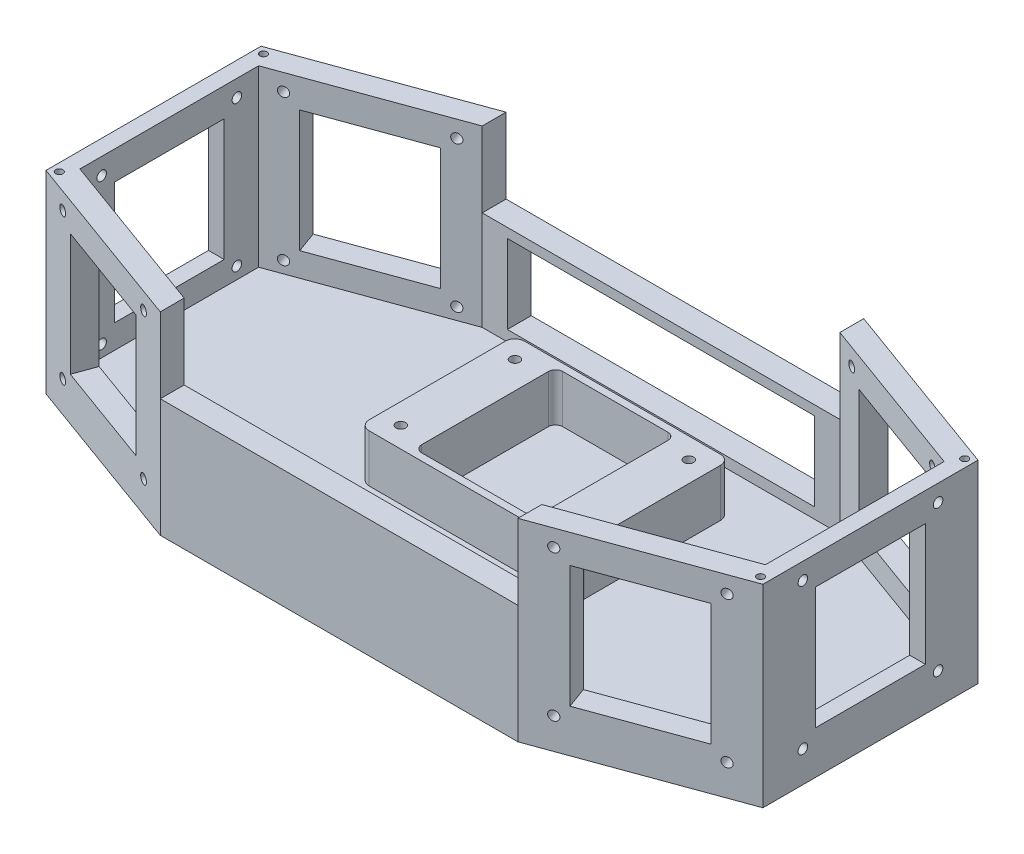
from build123d import *

# Parameters (mm, degrees)
BOSS_EXTRUDE1_DEPTH     = 8
SKETCH2_W               = 10.5
SKETCH2_H               = 10
BOSS_EXTRUDE2_DEPTH     = 37.5
SKETCH4_W               = 128.649180674
SKETCH4_H               = 10
BOSS_EXTRUDE4_DEPTH     = 4.5
BOSS_EXTRUDE5_DEPTH     = 10
SKETCH6_W               = 149.649180674
SKETCH6_H               = 10
BOSS_EXTRUDE6_DEPTH     = 4
CUT_EXTRUDE1_REACH      = 249.54
SKETCH7_R               = 2
MIRROR2_COPY_1_REACH    = 249.54
MIRROR2_COPY_1_SKETCH_R = 2
CUT_EXTRUDE2_REACH      = 314.548
SKETCH8_R               = 2
BOSS_EXTRUDE8_DEPTH     = 63
CUT_EXTRUDE3_REACH      = 257.708
SKETCH10_R              = 2
MIRROR5_COPY_1_REACH    = 257.708
MIRROR5_COPY_1_SKETCH_R = 2
CUT_EXTRUDE4_REACH      = 321.057
SKETCH11_R              = 2
SKETCH12_W              = 6.577848346
SKETCH12_H              = 46
BOSS_EXTRUDE9_DEPTH     = 12
BOSS_EXTRUDE10_DEPTH    = 20
SKETCH14_R              = 2
CUT_EXTRUDE5_DEPTH      = 10
SKETCH15_W              = 149.649180674
SKETCH15_H              = 10
BOSS_EXTRUDE11_DEPTH    = 41.5
SKETCH17_R              = 1.5
CUT_EXTRUDE6_DEPTH      = 10


with BuildPart() as part:
    # Sketch1 → Boss-Extrude1 (new body)
    with BuildSketch(Plane(origin=(0, 0, 0), x_dir=(1, 0, 0), z_dir=(0, 1, 0))):
        Polygon((-150, 45), (-150, -45), (-74.824590337, -72.361611466), (74.824590337, -72.361611466), (150, -45), (150, 45), (74.824590337, 72.361611466), (-74.824590337, 72.361611466), align=None)
    extrude(amount=BOSS_EXTRUDE1_DEPTH)

    # Sketch2 → Boss-Extrude2 (add)
    with BuildSketch(Plane(origin=(0, 8, 0), x_dir=(1, 0, 0), z_dir=(0, 1, 0))):
        with Locations((69.574590337, 67.361611466)):
            Rectangle(SKETCH2_W, SKETCH2_H)
        with Locations((-69.574590337, 67.361611466)):
            Rectangle(SKETCH2_W, SKETCH2_H)
    extrude(amount=BOSS_EXTRUDE2_DEPTH)

    # Sketch4 → Boss-Extrude4 (add)
    with BuildSketch(Plane(origin=(0, 8, 0), x_dir=(1, 0, 0), z_dir=(0, 1, 0))):
        with Locations((0, 67.361611466)):
            Rectangle(SKETCH4_W, SKETCH4_H)
    extrude(amount=BOSS_EXTRUDE4_DEPTH)

    # Sketch5 → Boss-Extrude5 (add)
    with BuildSketch(Plane(origin=(0, 8, 0), x_dir=(1, 0, 0), z_dir=(0, 1, 0))):
        Polygon((-74.824590337, 62.361611466), (-87.040594407, 57.915349603), (-140.603073792, 38.420201433), (-143.422151654, 37.394141003), (-143.422151654, -37.394141003), (-140.603073792, -38.420201433), (-87.040594407, -57.915349603), (-74.824590337, -62.361611466), (-74.824590337, -72.361611466), (-150, -45), (-150, 45), (-74.824590337, 72.361611466), align=None)
        Polygon((150, 45), (150, -45), (74.824590337, -72.361611466), (74.824590337, -62.361611466), (87.040594407, -57.915349603), (140.603073792, -38.420201433), (143.422151654, -37.394141003), (143.422151654, 37.394141003), (140.603073792, 38.420201433), (87.040594407, 57.915349603), (74.824590337, 62.361611466), (74.824590337, 72.361611466), align=None)
    extrude(amount=BOSS_EXTRUDE5_DEPTH)

    # Sketch6 → Boss-Extrude6 (add)
    with BuildSketch(Plane(origin=(0, 45.5, 0), x_dir=(1, 0, 0), z_dir=(0, 1, 0))):
        with Locations((0, 67.361611466)):
            Rectangle(SKETCH6_W, SKETCH6_H)
    extrude(amount=BOSS_EXTRUDE6_DEPTH)

    # Sketch7 → Cut-Extrude1 (cut, up to next)
    with BuildSketch(Plane(origin=(32.009387984, 0, -87.945070697), x_dir=(-0.9396926207859068, 0, -0.3420201433256732), z_dir=(0.3420201433256732, 0, -0.9396926207859068)), mode=Mode.PRIVATE) as cut_extrude1_sk1:
        with Locations((-113.852986668, 13)):
            Circle(SKETCH7_R)
    cut_extrude1_tool1 = extrude(cut_extrude1_sk1.sketch, amount=-CUT_EXTRUDE1_REACH, mode=Mode.PRIVATE) & part.part
    # Sketch7 → Cut-Extrude1 (cut, up to next)
    with BuildSketch(Plane(origin=(32.009387984, 0, -87.945070697), x_dir=(-0.9396926207859068, 0, -0.3420201433256732), z_dir=(0.3420201433256732, 0, -0.9396926207859068)), mode=Mode.PRIVATE) as cut_extrude1_sk2:
        with Locations((-57.272986668, 13)):
            Circle(SKETCH7_R)
    cut_extrude1_tool2 = extrude(cut_extrude1_sk2.sketch, amount=-CUT_EXTRUDE1_REACH, mode=Mode.PRIVATE) & part.part
    cut_extrude1_1 = cut_extrude1_tool1.solids().sort_by_distance((138.996199, 13, -49.005056))[0]
    add(cut_extrude1_1, mode=Mode.SUBTRACT)
    cut_extrude1_2 = cut_extrude1_tool2.solids().sort_by_distance((85.828391, 13, -68.356556))[0]
    add(cut_extrude1_2, mode=Mode.SUBTRACT)
    cut_extrude1 = cut_extrude1_1 + cut_extrude1_2  # Cut-Extrude1 as one shape, for the pattern or mirror that repeats it

    # Mirror1: Cut-Extrude1 across plane
    add(cut_extrude1.mirror(Plane(origin=(0, 0, 0), x_dir=(0, 0, 1), z_dir=(1, 0, 0))), mode=Mode.SUBTRACT)

    # Mirror2: Cut-Extrude1 across plane
    add(cut_extrude1.mirror(Plane(origin=(0, 0, 0), x_dir=(1, 0, 0), z_dir=(0, 0, -1))), mode=Mode.SUBTRACT)

    # Mirror2 copy 1 sketch → Mirror2 copy 1 (cut, up to next)
    with BuildSketch(Plane(origin=(-32.009387984, 0, 87.945070697), x_dir=(0.9396926207859068, 0, 0.3420201433256732), z_dir=(-0.3420201433256732, 0, 0.9396926207859068)), mode=Mode.PRIVATE) as mirror2_copy_1_sk1:
        with Locations((-113.852986668, 13)):
            Circle(MIRROR2_COPY_1_SKETCH_R)
    mirror2_copy_1_tool1 = extrude(mirror2_copy_1_sk1.sketch, amount=-MIRROR2_COPY_1_REACH, mode=Mode.PRIVATE) & part.part
    # Mirror2 copy 1 sketch → Mirror2 copy 1 (cut, up to next)
    with BuildSketch(Plane(origin=(-32.009387984, 0, 87.945070697), x_dir=(0.9396926207859068, 0, 0.3420201433256732), z_dir=(-0.3420201433256732, 0, 0.9396926207859068)), mode=Mode.PRIVATE) as mirror2_copy_1_sk2:
        with Locations((-57.272986668, 13)):
            Circle(MIRROR2_COPY_1_SKETCH_R)
    mirror2_copy_1_tool2 = extrude(mirror2_copy_1_sk2.sketch, amount=-MIRROR2_COPY_1_REACH, mode=Mode.PRIVATE) & part.part
    add(mirror2_copy_1_tool1.solids().sort_by_distance((-138.996199, 13, 49.005056))[0], mode=Mode.SUBTRACT)
    add(mirror2_copy_1_tool2.solids().sort_by_distance((-85.828391, 13, 68.356556))[0], mode=Mode.SUBTRACT)

    # Sketch8 → Cut-Extrude2 (cut, up to next)
    with BuildSketch(Plane(origin=(150, 0, 0), x_dir=(0, 0, -1), z_dir=(1, 0, 0)), mode=Mode.PRIVATE) as cut_extrude2_sk1:
        with Locations((-28.29, 13)):
            Circle(SKETCH8_R)
    cut_extrude2_tool1 = extrude(cut_extrude2_sk1.sketch, amount=-CUT_EXTRUDE2_REACH, mode=Mode.PRIVATE) & part.part
    # Sketch8 → Cut-Extrude2 (cut, up to next)
    with BuildSketch(Plane(origin=(150, 0, 0), x_dir=(0, 0, -1), z_dir=(1, 0, 0)), mode=Mode.PRIVATE) as cut_extrude2_sk2:
        with Locations((28.29, 13)):
            Circle(SKETCH8_R)
    cut_extrude2_tool2 = extrude(cut_extrude2_sk2.sketch, amount=-CUT_EXTRUDE2_REACH, mode=Mode.PRIVATE) & part.part
    cut_extrude2_1 = cut_extrude2_tool1.solids().sort_by_distance((150, 13, 28.29))[0]
    add(cut_extrude2_1, mode=Mode.SUBTRACT)
    cut_extrude2_2 = cut_extrude2_tool2.solids().sort_by_distance((150, 13, -28.29))[0]
    add(cut_extrude2_2, mode=Mode.SUBTRACT)
    cut_extrude2 = cut_extrude2_1 + cut_extrude2_2  # Cut-Extrude2 as one shape, for the pattern or mirror that repeats it

    # Mirror3: Cut-Extrude2 across plane
    add(cut_extrude2.mirror(Plane(origin=(0, 0, 0), x_dir=(0, 0, 1), z_dir=(1, 0, 0))), mode=Mode.SUBTRACT)

    # Sketch9 → Boss-Extrude8 (add)
    with BuildSketch(Plane(origin=(0, 18, 0), x_dir=(1, 0, 0), z_dir=(0, 1, 0))):
        Polygon((143.422151654, 23), (150, 23), (150, 45), (134.025225447, 50.814342437), (130.811287398, 41.984120221), (143.422151654, 37.394141003), align=None)
        Polygon((74.824590337, 72.361611466), (90.79936489, 66.54726903), (87.585426842, 57.717046814), (74.824590337, 62.361611466), align=None)
        Polygon((-74.824590337, 62.361611466), (-74.824590337, 72.361611466), (-90.79936489, 66.54726903), (-87.585426842, 57.717046814), align=None)
        Polygon((-143.422151654, 37.394141003), (-143.422151654, 23), (-150, 23), (-150, 45), (-134.025225447, 50.814342437), (-130.811287398, 41.984120221), align=None)
        Polygon((143.422151654, -37.394141003), (143.422151654, -23), (150, -23), (150, -45), (134.025225447, -50.814342437), (130.811287398, -41.984120221), align=None)
        Polygon((-143.422151654, -23), (-150, -23), (-150, -45), (-134.025225447, -50.814342437), (-130.811287398, -41.984120221), (-143.422151654, -37.394141003), align=None)
        Polygon((-74.824590337, -72.361611466), (-90.79936489, -66.54726903), (-87.585426842, -57.717046814), (-74.824590337, -62.361611466), align=None)
        Polygon((74.824590337, -62.361611466), (74.824590337, -72.361611466), (90.79936489, -66.54726903), (87.585426842, -57.717046814), align=None)
    extrude(amount=BOSS_EXTRUDE8_DEPTH)

    # Sketch10 → Cut-Extrude3 (cut, up to next)
    with BuildSketch(Plane(origin=(32.009387984, 0, -87.945070697), x_dir=(-0.9396926207859068, 0, -0.3420201433256732), z_dir=(0.3420201433256732, 0, -0.9396926207859068)), mode=Mode.PRIVATE) as cut_extrude3_sk1:
        with Locations((-113.852986668, 74)):
            Circle(SKETCH10_R)
    cut_extrude3_tool1 = extrude(cut_extrude3_sk1.sketch, amount=-CUT_EXTRUDE3_REACH, mode=Mode.PRIVATE) & part.part
    # Sketch10 → Cut-Extrude3 (cut, up to next)
    with BuildSketch(Plane(origin=(32.009387984, 0, -87.945070697), x_dir=(-0.9396926207859068, 0, -0.3420201433256732), z_dir=(0.3420201433256732, 0, -0.9396926207859068)), mode=Mode.PRIVATE) as cut_extrude3_sk2:
        with Locations((-57.272986668, 74)):
            Circle(SKETCH10_R)
    cut_extrude3_tool2 = extrude(cut_extrude3_sk2.sketch, amount=-CUT_EXTRUDE3_REACH, mode=Mode.PRIVATE) & part.part
    cut_extrude3_1 = cut_extrude3_tool1.solids().sort_by_distance((138.996199, 74, -49.005056))[0]
    add(cut_extrude3_1, mode=Mode.SUBTRACT)
    cut_extrude3_2 = cut_extrude3_tool2.solids().sort_by_distance((85.828391, 74, -68.356556))[0]
    add(cut_extrude3_2, mode=Mode.SUBTRACT)
    cut_extrude3 = cut_extrude3_1 + cut_extrude3_2  # Cut-Extrude3 as one shape, for the pattern or mirror that repeats it

    # Mirror4: Cut-Extrude3 across plane
    add(cut_extrude3.mirror(Plane(origin=(0, 0, 0), x_dir=(0, 0, 1), z_dir=(1, 0, 0))), mode=Mode.SUBTRACT)

    # Mirror5: Cut-Extrude3 across plane
    add(cut_extrude3.mirror(Plane(origin=(0, 0, 0), x_dir=(1, 0, 0), z_dir=(0, 0, -1))), mode=Mode.SUBTRACT)

    # Mirror5 copy 1 sketch → Mirror5 copy 1 (cut, up to next)
    with BuildSketch(Plane(origin=(-32.009387984, 0, 87.945070697), x_dir=(0.9396926207859068, 0, 0.3420201433256732), z_dir=(-0.3420201433256732, 0, 0.9396926207859068)), mode=Mode.PRIVATE) as mirror5_copy_1_sk1:
        with Locations((-113.852986668, 74)):
            Circle(MIRROR5_COPY_1_SKETCH_R)
    mirror5_copy_1_tool1 = extrude(mirror5_copy_1_sk1.sketch, amount=-MIRROR5_COPY_1_REACH, mode=Mode.PRIVATE) & part.part
    # Mirror5 copy 1 sketch → Mirror5 copy 1 (cut, up to next)
    with BuildSketch(Plane(origin=(-32.009387984, 0, 87.945070697), x_dir=(0.9396926207859068, 0, 0.3420201433256732), z_dir=(-0.3420201433256732, 0, 0.9396926207859068)), mode=Mode.PRIVATE) as mirror5_copy_1_sk2:
        with Locations((-57.272986668, 74)):
            Circle(MIRROR5_COPY_1_SKETCH_R)
    mirror5_copy_1_tool2 = extrude(mirror5_copy_1_sk2.sketch, amount=-MIRROR5_COPY_1_REACH, mode=Mode.PRIVATE) & part.part
    add(mirror5_copy_1_tool1.solids().sort_by_distance((-138.996199, 74, 49.005056))[0], mode=Mode.SUBTRACT)
    add(mirror5_copy_1_tool2.solids().sort_by_distance((-85.828391, 74, 68.356556))[0], mode=Mode.SUBTRACT)

    # Sketch11 → Cut-Extrude4 (cut, up to next)
    with BuildSketch(Plane(origin=(150, 0, 0), x_dir=(0, 0, -1), z_dir=(1, 0, 0)), mode=Mode.PRIVATE) as cut_extrude4_sk1:
        with Locations((-28.29, 74)):
            Circle(SKETCH11_R)
    cut_extrude4_tool1 = extrude(cut_extrude4_sk1.sketch, amount=-CUT_EXTRUDE4_REACH, mode=Mode.PRIVATE) & part.part
    # Sketch11 → Cut-Extrude4 (cut, up to next)
    with BuildSketch(Plane(origin=(150, 0, 0), x_dir=(0, 0, -1), z_dir=(1, 0, 0)), mode=Mode.PRIVATE) as cut_extrude4_sk2:
        with Locations((28.29, 74)):
            Circle(SKETCH11_R)
    cut_extrude4_tool2 = extrude(cut_extrude4_sk2.sketch, amount=-CUT_EXTRUDE4_REACH, mode=Mode.PRIVATE) & part.part
    cut_extrude4_1 = cut_extrude4_tool1.solids().sort_by_distance((150, 74, 28.29))[0]
    add(cut_extrude4_1, mode=Mode.SUBTRACT)
    cut_extrude4_2 = cut_extrude4_tool2.solids().sort_by_distance((150, 74, -28.29))[0]
    add(cut_extrude4_2, mode=Mode.SUBTRACT)
    cut_extrude4 = cut_extrude4_1 + cut_extrude4_2  # Cut-Extrude4 as one shape, for the pattern or mirror that repeats it

    # Mirror6: Cut-Extrude4 across plane
    add(cut_extrude4.mirror(Plane(origin=(0, 0, 0), x_dir=(0, 0, 1), z_dir=(1, 0, 0))), mode=Mode.SUBTRACT)

    # Sketch12 → Boss-Extrude9 (add)
    with BuildSketch(Plane(origin=(0, 81, 0), x_dir=(1, 0, 0), z_dir=(0, 1, 0))):
        Polygon((130.811287398, 41.984120221), (87.585426842, 57.717046814), (90.79936489, 66.54726903), (134.025225447, 50.814342437), align=None)
        with Locations((146.711075827, 0)):
            Rectangle(SKETCH12_W, SKETCH12_H)
        Polygon((134.025225447, -50.814342437), (130.811287398, -41.984120221), (87.585426842, -57.717046814), (90.79936489, -66.54726903), align=None)
        Polygon((-130.811287398, -41.984120221), (-87.585426842, -57.717046814), (-90.79936489, -66.54726903), (-134.025225447, -50.814342437), align=None)
        with Locations((-146.711075827, 0)):
            Rectangle(SKETCH12_W, SKETCH12_H)
        Polygon((-134.025225447, 50.814342437), (-130.811287398, 41.984120221), (-87.585426842, 57.717046814), (-90.79936489, 66.54726903), align=None)
    extrude(amount=-BOSS_EXTRUDE9_DEPTH)

    # Sketch13 → Boss-Extrude10 (add)
    with BuildSketch(Plane(origin=(0, 8, 0), x_dir=(1, 0, 0), z_dir=(0, 1, 0))):
        with BuildLine():
            Line((-41, 46.231611466), (-29, 46.231611466))
            Line((-29, 46.231611466), (29, 46.231611466))
            Line((29, 46.231611466), (41, 46.231611466))
            ThreePointArc((41, 46.231611466), (43.828427125, 45.060038591), (45, 42.231611466))
            Line((45, 42.231611466), (45, -14.768388534))
            ThreePointArc((45, -14.768388534), (43.828427125, -17.596815659), (41, -18.768388534))
            Line((41, -18.768388534), (29, -18.768388534))
            Line((29, -18.768388534), (-29, -18.768388534))
            Line((-29, -18.768388534), (-41, -18.768388534))
            ThreePointArc((-41, -18.768388534), (-43.828427125, -17.596815659), (-45, -14.768388534))
            Line((-45, -14.768388534), (-45, 42.231611466))
            ThreePointArc((-45, 42.231611466), (-43.828427125, 45.060038591), (-41, 46.231611466))
        make_face()
        with BuildLine():
            Line((-25, 40.231611466), (-25, -12.768388534))
            ThreePointArc((-25, -12.768388534), (-24.121320344, -14.889708878), (-22, -15.768388534))
            Line((-22, -15.768388534), (22, -15.768388534))
            ThreePointArc((22, -15.768388534), (24.121320344, -14.889708878), (25, -12.768388534))
            Line((25, -12.768388534), (25, 40.231611466))
            ThreePointArc((25, 40.231611466), (24.121320344, 42.35293181), (22, 43.231611466))
            Line((22, 43.231611466), (-22, 43.231611466))
            ThreePointArc((-22, 43.231611466), (-24.121320344, 42.35293181), (-25, 40.231611466))
        make_face(mode=Mode.SUBTRACT)
    extrude(amount=BOSS_EXTRUDE10_DEPTH)

    # Sketch14 → Cut-Extrude5 (cut)
    with BuildSketch(Plane(origin=(0, 28, 0), x_dir=(1, 0, 0), z_dir=(0, 1, 0))):
        with Locations((-36.37, 37.606611466)):
            Circle(SKETCH14_R)
        with Locations((-36.37, -10.143388534)):
            Circle(SKETCH14_R)
    cut_extrude5 = extrude(amount=-CUT_EXTRUDE5_DEPTH, mode=Mode.SUBTRACT)

    # Mirror7: Cut-Extrude5 across plane
    add(cut_extrude5.mirror(Plane(origin=(0, 0, 0), x_dir=(0, 0, 1), z_dir=(1, 0, 0))), mode=Mode.SUBTRACT)

    # Sketch15 → Boss-Extrude11 (add)
    with BuildSketch(Plane(origin=(0, 8, 0), x_dir=(1, 0, 0), z_dir=(0, 1, 0))):
        with Locations((0, -67.361611466)):
            Rectangle(SKETCH15_W, SKETCH15_H)
    extrude(amount=BOSS_EXTRUDE11_DEPTH)

    # Sketch17 → Cut-Extrude6 (cut)
    with BuildSketch(Plane(origin=(0, 81, 0), x_dir=(1, 0, 0), z_dir=(0, 1, 0))):
        with Locations((146.723391823, -42.705694255)):
            Circle(SKETCH17_R)
        with Locations((146.723391823, 42.705694255)):
            Circle(SKETCH17_R)
        with Locations((-146.723391823, 42.705694255)):
            Circle(SKETCH17_R)
        with Locations((-146.723391823, -42.705694255)):
            Circle(SKETCH17_R)
    extrude(amount=-CUT_EXTRUDE6_DEPTH, mode=Mode.SUBTRACT)


solid = part.part
